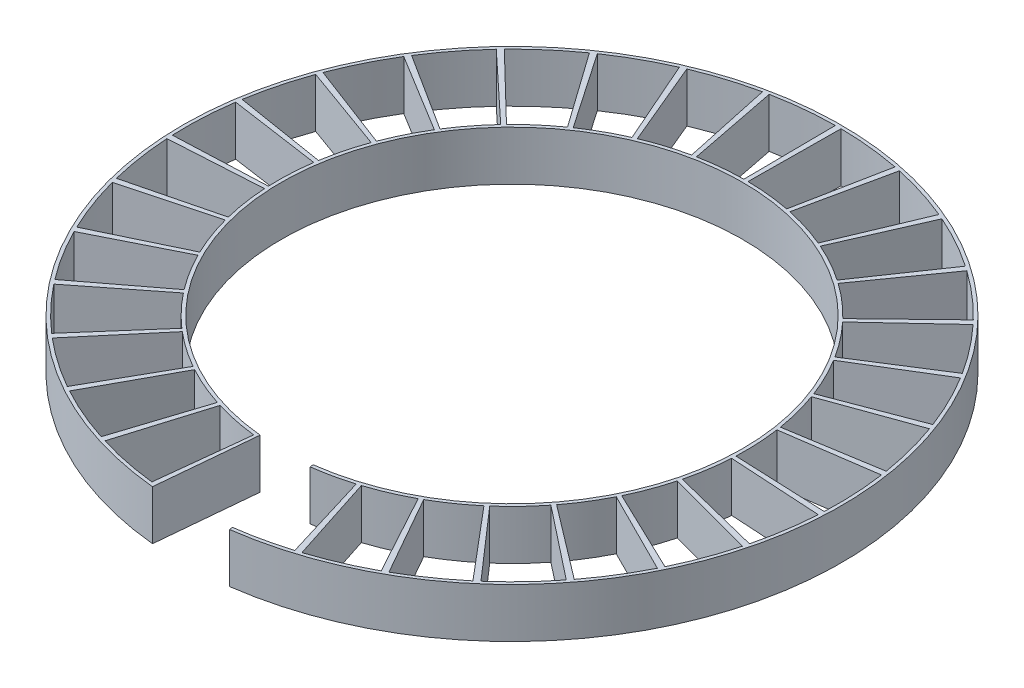
from build123d import *

# Parameters (mm, degrees)
RESSALTO_EXTRUS_O1_OUTLINE_R   = 100
RESSALTO_EXTRUS_O1_OUTLINE_R_2 = 70
RESSALTO_EXTRUS_O1_DEPTH       = 15
CORTE_EXTRUS_O1_DEPTH          = 143.214626533


# Read off the part's stored shape, not the designer's step: Ressalto-extrusão1
with BuildPart() as part:
    # Ressalto-extrusão1 outline → Ressalto-extrusão1 (new body)
    with BuildSketch(Plane(origin=(0, 0, 0), x_dir=(1, 0, 0), z_dir=(0, 1, 0))):
        Circle(RESSALTO_EXTRUS_O1_OUTLINE_R)
        with BuildLine():
            Line((-46.71579972, -53.466195456), (-65.138932004, -74.551455635))
            ThreePointArc((-65.138932004, -74.551455635), (-71.754485936, -68.207724989), (-77.755002141, -61.279357389))
            Line((-77.755002141, -61.279357389), (-55.763688404, -43.947821966))
            ThreePointArc((-55.763688404, -43.947821966), (-51.460287893, -48.916651255), (-46.71579972, -53.466195456))
        make_face(mode=Mode.SUBTRACT)
        with BuildLine():
            Line((-21.845141851, -67.555827117), (-30.460127369, -94.197561755))
            ThreePointArc((-30.460127369, -94.197561755), (-39.041229656, -90.97682335), (-47.287693227, -86.976284522))
            Line((-47.287693227, -86.976284522), (-33.913396152, -62.376931324))
            ThreePointArc((-33.913396152, -62.376931324), (-27.999265713, -65.246004625), (-21.845141851, -67.555827117))
        make_face(mode=Mode.SUBTRACT)
        with BuildLine():
            Line((-7.799082491, -70.570350093), (-10.874776995, -98.400910693))
            ThreePointArc((-10.874776995, -98.400910693), (-19.928553489, -96.973464184), (-28.811514011, -94.714817533))
            Line((-28.811514011, -94.714817533), (-20.662802978, -67.926788332))
            ThreePointArc((-20.662802978, -67.926788332), (-14.292194926, -69.546625829), (-7.799082491, -70.570350093))
        make_face(mode=Mode.SUBTRACT)
        with BuildLine():
            Line((-34.996858536, -61.775560642), (-48.79843655, -86.137753571))
            ThreePointArc((-48.79843655, -86.137753571), (-56.555553294, -81.25558068), (-63.827908725, -75.676932204))
            Line((-63.827908725, -75.676932204), (-45.775570904, -54.273355419))
            ThreePointArc((-45.775570904, -54.273355419), (-40.560043272, -58.274204326), (-34.996858536, -61.775560642))
        make_face(mode=Mode.SUBTRACT)
        with BuildLine():
            Line((-64.014556308, -30.710528825), (-89.259733443, -42.821723292))
            ThreePointArc((-89.259733443, -42.821723292), (-92.837461083, -34.383220032), (-95.619439994, -25.650003805))
            Line((-95.619439994, -25.650003805), (-68.575557976, -18.395457274))
            ThreePointArc((-68.575557976, -18.395457274), (-66.580401382, -24.658672952), (-64.014556308, -30.710528825))
        make_face(mode=Mode.SUBTRACT)
        with BuildLine():
            Line((-56.522190576, -42.967917945), (-78.812631929, -59.913012346))
            ThreePointArc((-78.812631929, -59.913012346), (-84.015781492, -52.367437022), (-88.498796634, -44.372998482))
            Line((-88.498796634, -44.372998482), (-63.46883395, -31.823059518))
            ThreePointArc((-63.46883395, -31.823059518), (-60.253742282, -37.556444733), (-56.522190576, -42.967917945))
        make_face(mode=Mode.SUBTRACT)
        with BuildLine():
            Line((-68.886158583, -17.195847047), (-96.052530982, -23.977307855))
            ThreePointArc((-96.052530982, -23.977307855), (-97.858364108, -14.991349973), (-98.825412246, -5.876894957))
            Line((-98.825412246, -5.876894957), (-70.874790601, -4.214742848))
            ThreePointArc((-70.874790601, -4.214742848), (-70.181251027, -10.751372203), (-68.886158583, -17.195847047))
        make_face(mode=Mode.SUBTRACT)
        with BuildLine():
            Line((6.566272221, -70.695714645), (9.155788027, -98.575714786))
            ThreePointArc((9.155788027, -98.575714786), (0, -99), (-9.155788027, -98.575714786))
            Line((-9.155788027, -98.575714786), (-6.566272221, -70.695714645))
            ThreePointArc((-6.566272221, -70.695714645), (0, -71), (6.566272221, -70.695714645))
        make_face(mode=Mode.SUBTRACT)
        with BuildLine():
            Line((20.662802978, -67.926788332), (28.811514011, -94.714817533))
            ThreePointArc((28.811514011, -94.714817533), (19.928553489, -96.973464184), (10.874776995, -98.400910693))
            Line((10.874776995, -98.400910693), (7.799082492, -70.570350093))
            ThreePointArc((7.799082492, -70.570350093), (14.292194927, -69.546625829), (20.662802978, -67.926788332))
        make_face(mode=Mode.SUBTRACT)
        with BuildLine():
            Line((33.913396152, -62.376931324), (47.287693227, -86.976284522))
            ThreePointArc((47.287693227, -86.976284522), (39.041229656, -90.97682335), (30.460127369, -94.197561755))
            Line((30.460127369, -94.197561755), (21.845141851, -67.555827117))
            ThreePointArc((21.845141851, -67.555827117), (27.999265713, -65.246004625), (33.913396152, -62.376931324))
        make_face(mode=Mode.SUBTRACT)
        with BuildLine():
            Line((45.775570904, -54.273355419), (63.827908725, -75.676932204))
            ThreePointArc((63.827908725, -75.676932204), (56.555553294, -81.255580679), (48.79843655, -86.137753571))
            Line((48.79843655, -86.137753571), (34.996858536, -61.775560642))
            ThreePointArc((34.996858536, -61.775560642), (40.560043272, -58.274204326), (45.775570904, -54.273355419))
        make_face(mode=Mode.SUBTRACT)
        with BuildLine():
            Line((55.763688405, -43.947821966), (77.755002142, -61.279357389))
            ThreePointArc((77.755002142, -61.279357389), (71.754485936, -68.207724988), (65.138932005, -74.551455635))
            Line((65.138932005, -74.551455635), (46.71579972, -53.466195455))
            ThreePointArc((46.71579972, -53.466195455), (51.460287893, -48.916651254), (55.763688405, -43.947821966))
        make_face(mode=Mode.SUBTRACT)
        with BuildLine():
            Line((63.46883395, -31.823059518), (88.498796634, -44.372998482))
            ThreePointArc((88.498796634, -44.372998482), (84.015781492, -52.367437022), (78.812631929, -59.913012346))
            Line((78.812631929, -59.913012346), (56.522190576, -42.967917945))
            ThreePointArc((56.522190576, -42.967917945), (60.253742282, -37.556444733), (63.46883395, -31.823059518))
        make_face(mode=Mode.SUBTRACT)
        with BuildLine():
            Line((68.575557976, -18.395457274), (95.619439994, -25.650003805))
            ThreePointArc((95.619439994, -25.650003805), (92.837461083, -34.383220032), (89.259733443, -42.821723292))
            Line((89.259733443, -42.821723292), (64.014556308, -30.710528825))
            ThreePointArc((64.014556308, -30.710528825), (66.580401382, -24.658672952), (68.575557976, -18.395457274))
        make_face(mode=Mode.SUBTRACT)
        with BuildLine():
            Line((70.874790601, -4.214742848), (98.825412246, -5.876894957))
            ThreePointArc((98.825412246, -5.876894957), (97.858364108, -14.991349973), (96.052530982, -23.977307855))
            Line((96.052530982, -23.977307855), (68.886158583, -17.195847047))
            ThreePointArc((68.886158583, -17.195847047), (70.181251027, -10.751372203), (70.874790601, -4.214742848))
        make_face(mode=Mode.SUBTRACT)
        with BuildLine():
            Line((-70.937553432, -2.977165271), (-98.912926617, -4.151258617))
            ThreePointArc((-98.912926617, -4.151258617), (-98.87293421, 5.014267715), (-97.98546051, 14.13681466))
            Line((-97.98546051, 14.13681466), (-70.272400971, 10.138523645))
            ThreePointArc((-70.272400971, 10.138523645), (-70.908872009, 3.596090987), (-70.937553432, -2.977165271))
        make_face(mode=Mode.SUBTRACT)
        with BuildLine():
            Line((-70.084756509, 11.363402002), (-97.723815414, 15.844743636))
            ThreePointArc((-97.723815414, 15.844743636), (-95.839634768, 24.814600693), (-93.133972507, 33.571761424))
            Line((-93.133972507, 33.571761424), (-66.79305099, 24.076717789))
            ThreePointArc((-66.79305099, 24.076717789), (-68.73347544, 17.79632979), (-70.084756509, 11.363402002))
        make_face(mode=Mode.SUBTRACT)
        with BuildLine():
            Line((-66.36268142, 25.238750261), (-92.533879726, 35.192060224))
            ThreePointArc((-92.533879726, 35.192060224), (-88.882649418, 43.599021004), (-84.469568727, 51.632276331))
            Line((-84.469568727, 51.632276331), (-60.579185652, 37.029208278))
            ThreePointArc((-60.579185652, 37.029208278), (-63.74412231, 31.267984761), (-66.36268142, 25.238750261))
        make_face(mode=Mode.SUBTRACT)
        with BuildLine():
            Line((-59.923710356, 38.08082112), (-83.55559613, 53.09860973))
            ThreePointArc((-83.55559613, 53.09860973), (-78.286797957, 60.598492272), (-72.346970878, 67.578959779))
            Line((-72.346970878, 67.578959779), (-51.885201337, 48.465718629))
            ThreePointArc((-51.885201337, 48.465718629), (-56.145077323, 43.459524761), (-59.923710356, 38.08082112))
        make_face(mode=Mode.SUBTRACT)
        with BuildLine():
            ThreePointArc((-41.067030782, 57.918036765), (-46.247446273, 53.871826711), (-51.03145555, 49.363858687))
            Line((-51.03145555, 49.363858687), (-71.156536611, 68.831295916))
            ThreePointArc((-71.156536611, 68.831295916), (-64.48587579, 75.117054147), (-57.262479541, 80.758952673))
            Line((-57.262479541, 80.758952673), (-41.067030782, 57.918036765))
        make_face(mode=Mode.SUBTRACT)
        with BuildLine():
            ThreePointArc((-28.567571162, 64.999183671), (-34.45643934, 62.078609746), (-40.049966957, 58.62593408))
            Line((-40.049966957, 58.62593408), (-55.844320123, 81.746020759))
            ThreePointArc((-55.844320123, 81.746020759), (-48.044894291, 86.560314998), (-39.833655564, 90.632664555))
            Line((-39.833655564, 90.632664555), (-28.567571162, 64.999183671))
        make_face(mode=Mode.SUBTRACT)
        with BuildLine():
            ThreePointArc((-14.898551822, 69.41925636), (-21.254781731, 67.743887204), (-27.428828011, 65.487856843))
            Line((-27.428828011, 65.487856843), (-38.245830607, 91.314053908))
            ThreePointArc((-38.245830607, 91.314053908), (-29.636949174, 94.459786384), (-20.774037048, 96.795864502))
            Line((-20.774037048, 96.795864502), (-14.898551822, 69.41925636))
        make_face(mode=Mode.SUBTRACT)
        with BuildLine():
            Line((-13.684749624, 69.668699053), (-19.081552293, 97.143678961))
            ThreePointArc((-19.081552293, 97.143678961), (-10.015663877, 98.492063016), (-0.863927014, 98.996230383))
            Line((-0.863927014, 98.996230383), (-0.61958402, 70.997296538))
            ThreePointArc((-0.61958402, 70.997296538), (-7.182950861, 70.635721961), (-13.684749624, 69.668699053))
        make_face(mode=Mode.SUBTRACT)
        Circle(RESSALTO_EXTRUS_O1_OUTLINE_R_2, mode=Mode.SUBTRACT)
        with BuildLine():
            Line((70.272400971, 10.138523645), (97.98546051, 14.13681466))
            ThreePointArc((97.98546051, 14.13681466), (98.87293421, 5.014267715), (98.912926617, -4.151258617))
            Line((98.912926617, -4.151258617), (70.937553432, -2.977165271))
            ThreePointArc((70.937553432, -2.977165271), (70.908872009, 3.596090987), (70.272400971, 10.138523645))
        make_face(mode=Mode.SUBTRACT)
        with BuildLine():
            Line((66.79305099, 24.076717789), (93.133972507, 33.571761424))
            ThreePointArc((93.133972507, 33.571761424), (95.839634768, 24.814600694), (97.723815414, 15.844743637))
            Line((97.723815414, 15.844743637), (70.084756509, 11.363402002))
            ThreePointArc((70.084756509, 11.363402002), (68.733475439, 17.79632979), (66.79305099, 24.076717789))
        make_face(mode=Mode.SUBTRACT)
        with BuildLine():
            Line((60.579185652, 37.029208278), (84.469568727, 51.632276331))
            ThreePointArc((84.469568727, 51.632276331), (88.882649417, 43.599021004), (92.533879726, 35.192060224))
            Line((92.533879726, 35.192060224), (66.36268142, 25.238750261))
            ThreePointArc((66.36268142, 25.238750261), (63.74412231, 31.267984761), (60.579185652, 37.029208278))
        make_face(mode=Mode.SUBTRACT)
        with BuildLine():
            ThreePointArc((40.049966957, 58.62593408), (34.45643934, 62.078609746), (28.567571162, 64.999183671))
            Line((28.567571162, 64.999183671), (39.833655564, 90.632664555))
            ThreePointArc((39.833655564, 90.632664555), (48.044894291, 86.560314998), (55.844320123, 81.746020759))
            Line((55.844320123, 81.746020759), (40.049966957, 58.62593408))
        make_face(mode=Mode.SUBTRACT)
        with BuildLine():
            ThreePointArc((13.684749624, 69.668699053), (7.182950861, 70.635721961), (0.61958402, 70.997296538))
            Line((0.61958402, 70.997296538), (0.863927014, 98.996230383))
            ThreePointArc((0.863927014, 98.996230383), (10.015663877, 98.492063016), (19.081552293, 97.143678961))
            Line((19.081552293, 97.143678961), (13.684749624, 69.668699053))
        make_face(mode=Mode.SUBTRACT)
        with BuildLine():
            ThreePointArc((27.428828011, 65.487856843), (21.254781731, 67.743887204), (14.898551822, 69.41925636))
            Line((14.898551822, 69.41925636), (20.774037048, 96.795864502))
            ThreePointArc((20.774037048, 96.795864502), (29.636949174, 94.459786384), (38.245830607, 91.314053908))
            Line((38.245830607, 91.314053908), (27.428828011, 65.487856843))
        make_face(mode=Mode.SUBTRACT)
        with BuildLine():
            Line((51.885201337, 48.465718629), (72.346970878, 67.578959779))
            ThreePointArc((72.346970878, 67.578959779), (78.286797957, 60.598492272), (83.55559613, 53.09860973))
            Line((83.55559613, 53.09860973), (59.923710356, 38.08082112))
            ThreePointArc((59.923710356, 38.08082112), (56.145077323, 43.459524761), (51.885201337, 48.465718629))
        make_face(mode=Mode.SUBTRACT)
        with BuildLine():
            Line((41.067030782, 57.918036765), (57.262479541, 80.758952673))
            ThreePointArc((57.262479541, 80.758952673), (64.485875789, 75.117054147), (71.156536611, 68.831295916))
            Line((71.156536611, 68.831295916), (51.03145555, 49.363858687))
            ThreePointArc((51.03145555, 49.363858687), (46.247446273, 53.871826711), (41.067030782, 57.918036765))
        make_face(mode=Mode.SUBTRACT)
    extrude(amount=RESSALTO_EXTRUS_O1_DEPTH)

    # Esboço2 → Corte-extrusão1 (cut, through all)
    with BuildSketch(Plane(origin=(0, 15, 0), x_dir=(1, 0, 0), z_dir=(0, 1, 0))):
        Polygon((-6.686906976, -68.804808982), (-10.066215223, -105.188102797), (14.625368553, -107.481476044), (8.701602716, -67.10533658), align=None)
    extrude(amount=-CORTE_EXTRUS_O1_DEPTH, mode=Mode.SUBTRACT)


solid = part.part
